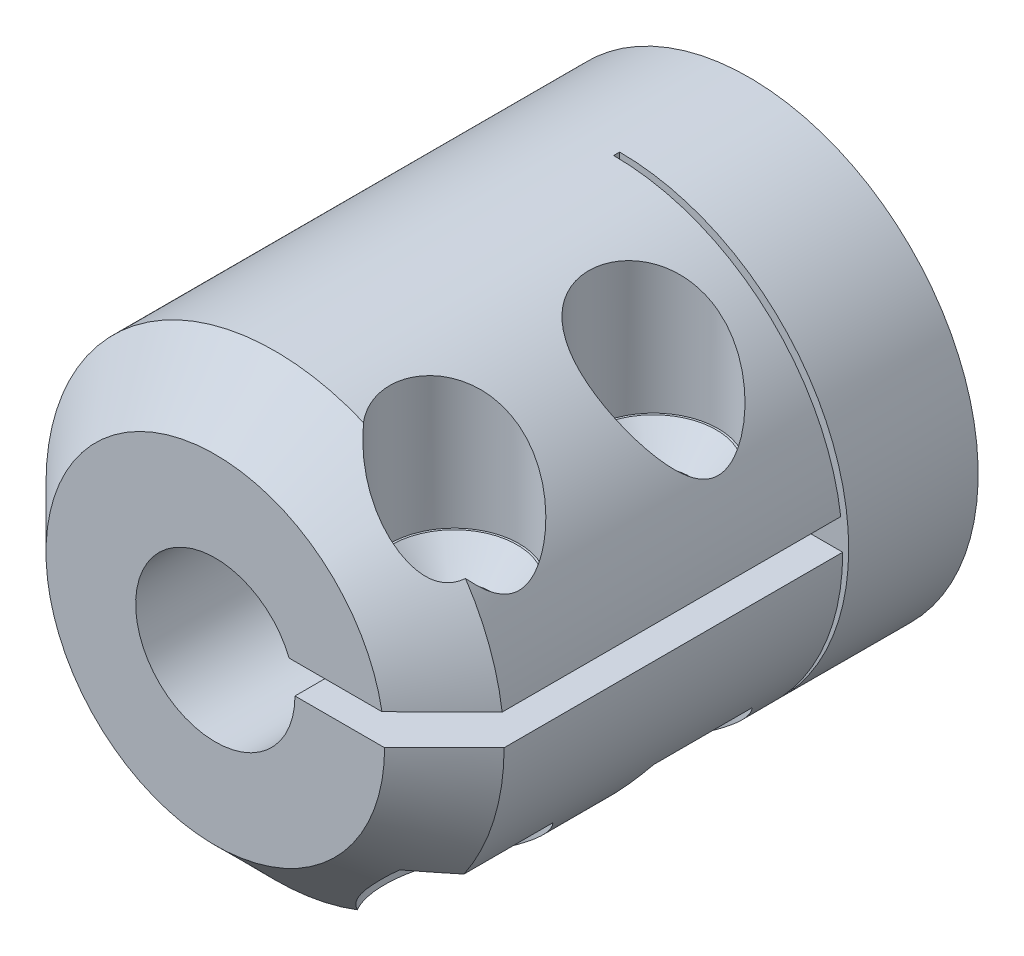
from build123d import *
from build123d.topology import SkipClean

# Parameters (mm, degrees)
SZKIC1_R                                           = 11.5
SZKIC1_R_2                                         = 4
DODANIE_WYCI_GNI_CIE1_DEPTH                        = 20
SZKIC3_W                                           = 11.5
SZKIC3_H                                           = 20
WYTNIJ_WYCI_GNI_CIE1_DEPTH                         = 1.5
WYTNIJ_WYCI_GNI_CIE2_DEPTH                         = 32
POG_BIENIE_STO_KOWE_POD_M3_WKR_T_Z_BEM_D           = 3.6
POG_BIENIE_STO_KOWE_POD_M3_WKR_T_Z_BEM_CSINK_D     = 6.3
POG_BIENIE_STO_KOWE_POD_M3_WKR_T_Z_BEM_CSINK_ANGLE = 90
SZKIC7_R                                           = 3.5
WYTNIJ_WYCI_GNI_CIE3_DEPTH                         = 32
SZKIC8_R                                           = 2
WYTNIJ_WYCI_GNI_CIE4_DEPTH                         = 7
DODANIE_WYCI_GNI_CIE2_START                        = 0.3
DODANIE_WYCI_GNI_CIE2_DEPTH                        = 0.3
DODANIE_WYCI_GNI_CIE3_START                        = 1.5
SZKIC10_R                                          = 11.5
DODANIE_WYCI_GNI_CIE3_DEPTH                        = 1.5
DODANIE_WYCI_GNI_CIE4_START                        = 5
SZKIC11_R                                          = 11.5
SZKIC11_W                                          = 10
SZKIC11_H                                          = 10
DODANIE_WYCI_GNI_CIE4_DEPTH                        = 5
SFAZOWANIE1_SIZE                                   = 3


with BuildPart() as part:
    # Szkic1 → Dodanie-wyciągnięcie1 (new body)
    with BuildSketch(Plane.XY):
        with Locations(Location((0, 0, 0), (0, 0, 180))):
            Circle(SZKIC1_R)
        with Locations(Location((0, 0, 0), (0, 0, 180))):
            Circle(SZKIC1_R_2, mode=Mode.SUBTRACT)
    extrude(amount=DODANIE_WYCI_GNI_CIE1_DEPTH)

    # Szkic3 → Wytnij-wyciągnięcie1 (cut)
    with BuildSketch(Plane(origin=(0, 0, 0), x_dir=(1, 0, 0), z_dir=(0, 1, 0))):
        with Locations((5.75, -10)):
            Rectangle(SZKIC3_W, SZKIC3_H)
    extrude(amount=WYTNIJ_WYCI_GNI_CIE1_DEPTH, mode=Mode.SUBTRACT)

    # Szkic4 → Wytnij-wyciągnięcie2 (cut)
    with BuildSketch(Plane(origin=(0, 4, 0), x_dir=(1, 0, 0), z_dir=(0, 1, 0))):
        with BuildLine():
            ThreePointArc((7, -11.75), (3.75, -15), (7, -18.25))
            Line((7, -18.25), (7, -11.75))
        make_face()
        with BuildLine():
            Line((7, -11.75), (7, -18.25))
            ThreePointArc((7, -18.25), (9.298097039, -17.298097039), (10.25, -15))
            ThreePointArc((10.25, -15), (9.298097039, -12.701902961), (7, -11.75))
        make_face()
        with BuildLine():
            ThreePointArc((7, -1.75), (3.75, -5), (7, -8.25))
            Line((7, -8.25), (7, -1.75))
        make_face()
        with BuildLine():
            Line((7, -1.75), (7, -8.25))
            ThreePointArc((7, -8.25), (9.298097039, -7.298097039), (10.25, -5))
            ThreePointArc((10.25, -5), (9.298097039, -2.701902961), (7, -1.75))
        make_face()
    extrude(amount=WYTNIJ_WYCI_GNI_CIE2_DEPTH, mode=Mode.SUBTRACT)

    # Pogłębienie stożkowe pod M3 Wkręt z łbem płaskim1 (through all)
    with Locations(Plane(origin=(7, 4, 15), x_dir=(0, 0, 1), z_dir=(0, 1, 0))):
        with Locations((0, 0), (-10, 0)):
            CounterSinkHole(POG_BIENIE_STO_KOWE_POD_M3_WKR_T_Z_BEM_D / 2, POG_BIENIE_STO_KOWE_POD_M3_WKR_T_Z_BEM_CSINK_D / 2, counter_sink_angle=POG_BIENIE_STO_KOWE_POD_M3_WKR_T_Z_BEM_CSINK_ANGLE)

    # Szkic7 → Wytnij-wyciągnięcie3 (cut)
    with BuildSketch(Plane(origin=(0, -6.5, 0), x_dir=(-1, 0, 0), z_dir=(0, -1, 0))):
        with Locations((-7, -5)):
            Circle(SZKIC7_R)
        with Locations((-7, -15)):
            Circle(SZKIC7_R)
    extrude(amount=WYTNIJ_WYCI_GNI_CIE3_DEPTH, mode=Mode.SUBTRACT)

    # Szkic8 → Wytnij-wyciągnięcie4 (cut)
    with BuildSketch(Plane.XZ.offset(6.5)):
        with Locations((7, 15)):
            Circle(SZKIC8_R)
        with Locations(Location((7, 5, 0), (0, 0, 90))):
            Circle(SZKIC8_R)
    extrude(amount=-WYTNIJ_WYCI_GNI_CIE4_DEPTH, mode=Mode.SUBTRACT)

    # Szkic9 → Dodanie-wyciągnięcie2 (add)
    with SkipClean():  # the faces are left unmerged after this step: merging them gives an invalid solid
        with BuildSketch(Plane(origin=(0, 0, 0), x_dir=(-1, 0, 0), z_dir=(0, 0, -1)).offset(DODANIE_WYCI_GNI_CIE2_START)):
            with BuildLine():
                Line((0, 11.5), (0, 4))
                ThreePointArc((0, 4), (4, 0), (0, -4))
                Line((0, -4), (0, -11.5))
                ThreePointArc((0, -11.5), (11.5, 0), (0, 11.5))
            make_face()
        extrude(amount=-DODANIE_WYCI_GNI_CIE2_DEPTH)

    # Szkic10 → Dodanie-wyciągnięcie3 (add)
    with SkipClean():  # the faces are left unmerged after this step: merging them gives an invalid solid
        with BuildSketch(Plane(origin=(0, 0, -0.3), x_dir=(-1, 0, 0), z_dir=(0, 0, -1)).offset(DODANIE_WYCI_GNI_CIE3_START)):
            Circle(SZKIC10_R)
        extrude(amount=-DODANIE_WYCI_GNI_CIE3_DEPTH)

    # Szkic11 → Dodanie-wyciągnięcie4 (add)
    with SkipClean():  # the faces are left unmerged after this step: merging them gives an invalid solid
        with BuildSketch(Plane(origin=(0, 0, -1.8), x_dir=(-1, 0, 0), z_dir=(0, 0, -1)).offset(DODANIE_WYCI_GNI_CIE4_START)):
            Circle(SZKIC11_R)
            Rectangle(SZKIC11_W, SZKIC11_H, mode=Mode.SUBTRACT)
        extrude(amount=-DODANIE_WYCI_GNI_CIE4_DEPTH)

    # Sfazowanie1
    # the kernel refuses this chamfer: 3 mm, written as the material it takes off along each edge
    with BuildSketch(Plane(origin=(0, 0, 20), x_dir=(-1, 0, 0), z_dir=(0, 1, 0))) as sfazowanie1_piece_1:
        Polygon((11.5, -SFAZOWANIE1_SIZE), (11.5 - SFAZOWANIE1_SIZE, 0), (11.5, 0), align=None)
    revolve(axis=Axis((0, 0, 20), (0, 0, 1)), revolution_arc=218.500054596, mode=Mode.SUBTRACT)
    with BuildSketch(Plane(origin=(0, 0, 20), x_dir=(0.8571646812696857, -0.5150424343525863, 0), z_dir=(-0.5150424343525863, -0.8571646812696857, 0))) as sfazowanie1_piece_2:
        Polygon((11.5, -SFAZOWANIE1_SIZE), (11.5 - SFAZOWANIE1_SIZE, 0), (11.5, 0), align=None)
    revolve(axis=Axis((0, 0, 20), (0, 0, 1)), revolution_arc=211.000291399, mode=Mode.SUBTRACT)


solid = part.part
